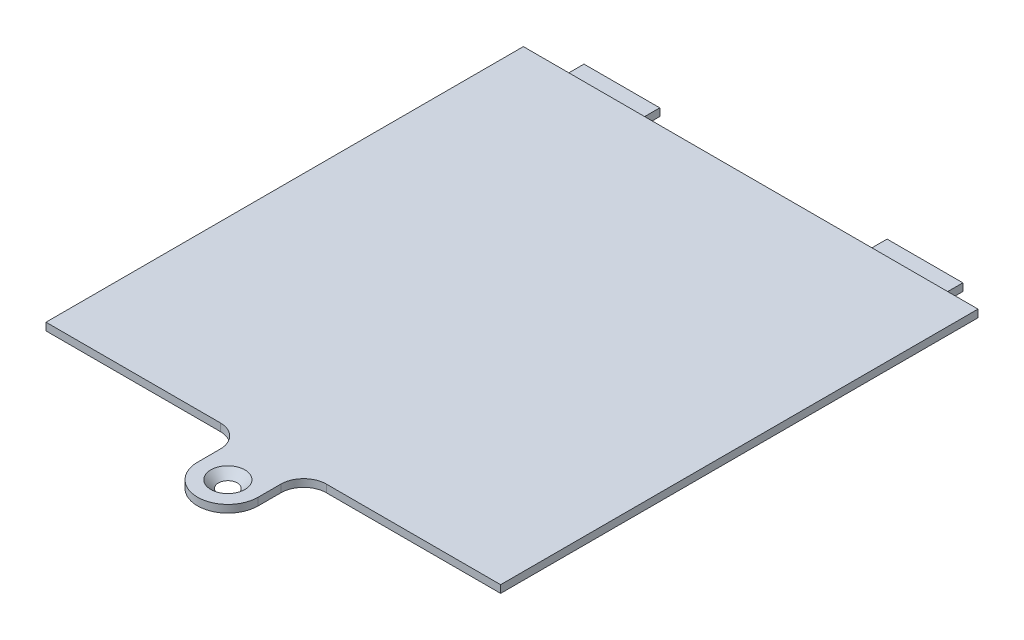
from build123d import *

# Parameters (mm, degrees)
SKETCH1_W           = 60
SKETCH1_H           = 63
SKETCH1_R           = 4
SKETCH1_R_2         = 1.25
BOSS_EXTRUDE1_DEPTH = 1
FILLET1_R           = 3
SKETCH2_W           = 10
SKETCH2_H           = 5
BOSS_EXTRUDE2_DEPTH = 1
CHAMFER1_SIZE       = 1
CHAMFER2_SIZE       = 1


with BuildPart() as part:
    # Sketch1 → Boss-Extrude1 (new body)
    # profile 1 of 3: a face of its own
    with BuildSketch(Plane(origin=(0, 0, 0), x_dir=(1, 0, 0), z_dir=(0, 1, 0))):
        with Locations((30, 31.5)):
            Rectangle(SKETCH1_W, SKETCH1_H)
    # profile 2 of 3: a face of its own
    with BuildSketch(Plane(origin=(0, 0, 0), x_dir=(1, 0, 0), z_dir=(0, 1, 0))):
        with BuildLine():
            Line((26, 0), (26, -6))
            ThreePointArc((26, -6), (30, -2), (34, -6))
            Line((34, -6), (34, 0))
            Line((34, 0), (26, 0))
        make_face()
    # profile 3 of 3: a face of its own
    with BuildSketch(Plane(origin=(0, 0, 0), x_dir=(1, 0, 0), z_dir=(0, 1, 0))):
        with Locations((30, -6)):
            Circle(SKETCH1_R)
        with Locations(Location((30, -6, 0), (0, 0, 270))):
            Circle(SKETCH1_R_2, mode=Mode.SUBTRACT)
    extrude(amount=BOSS_EXTRUDE1_DEPTH)

    # Fillet1
    fillet1_edges = [part.edges().sort_by_distance(p)[0] for p in [
        (34, 0.5, 0),
        (26, 0.5, 0),
    ]]
    fillet(fillet1_edges, radius=FILLET1_R)

    # Sketch2 → Boss-Extrude2 (add)
    with BuildSketch(Plane(origin=(0, 0, 0), x_dir=(-1, 0, 0), z_dir=(0, -1, 0))):
        with Locations((-10, 63.5)):
            Rectangle(SKETCH2_W, SKETCH2_H)
        with Locations((-50, 63.5)):
            Rectangle(SKETCH2_W, SKETCH2_H)
    extrude(amount=BOSS_EXTRUDE2_DEPTH)

    # Chamfer1
    chamfer1_edges = [part.edges().sort_by_distance(p)[0] for p in [
        (50, 0, -61),
        (10, 0, -61),
    ]]
    chamfer(chamfer1_edges, length=CHAMFER1_SIZE - 0.0001)  # a hair under: the kernel refuses the full size

    # Chamfer2
    chamfer2_edges = [part.edges().sort_by_distance(p)[0] for p in [
        (30, 1, 4.75),
    ]]
    chamfer(chamfer2_edges, length=CHAMFER2_SIZE - 0.0001)  # a hair under: the kernel refuses the full size


solid = part.part
